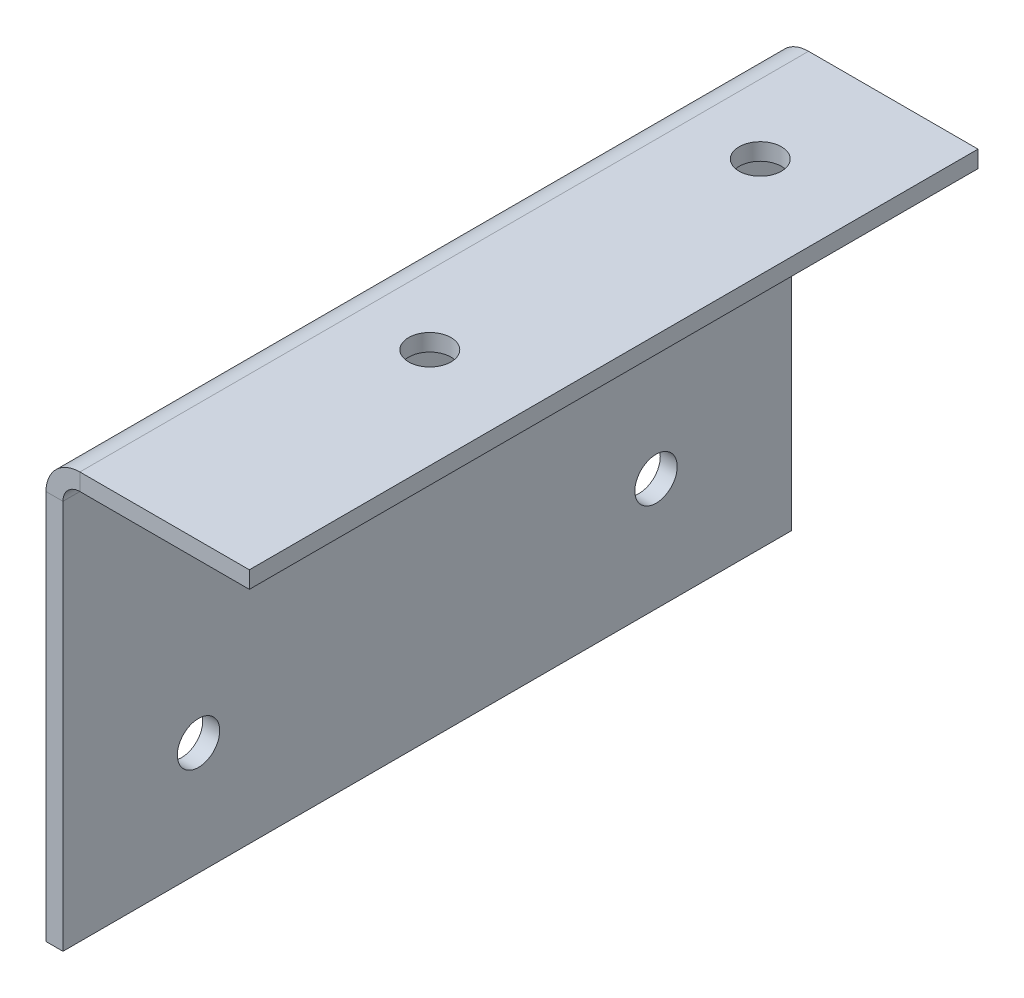
from build123d import *

# Parameters (mm, degrees)
SKETCH1_W                    = 43
SKETCH1_H                    = 25
BASE_FLANGE1_DEPTH           = 1
EDGE_FLANGE1_STRIP_W         = 6
EDGE_FLANGE1_STRIP_H         = 1
EDGE_FLANGE1_STRIP_CUT_DEPTH = 43
EDGE_FLANGE1_DEPTH           = 43
TAP_DRILL_FOR_M3_TAP1_D      = 2.5
TAP_DRILL_FOR_M3_TAP2_D      = 2.5
TAP_DRILL_FOR_M3_TAP2_DEPTH  = 10
TAP_DRILL_FOR_M3_TAP2_TIP    = 0.751075774


# Sheet-metal steps are written as plain solids
with BuildPart() as part:
    # Sketch1 → Base-Flange1 (new body)
    with BuildSketch(Plane(origin=(0, 0, 0), x_dir=(0, 0, -1), z_dir=(1, 0, 0))):
        Rectangle(SKETCH1_W, SKETCH1_H)
    extrude(amount=-BASE_FLANGE1_DEPTH)

    # Edge-Flange1 strip (across the edge) → Edge-Flange1 strip cut (cut)
    with BuildSketch(Plane(origin=(0, 12.5, -21.5), x_dir=(0, -1, 0), z_dir=(0, 0, 1))):
        with Locations((-1, -0.5)):
            Rectangle(EDGE_FLANGE1_STRIP_W, EDGE_FLANGE1_STRIP_H)
    extrude(amount=EDGE_FLANGE1_STRIP_CUT_DEPTH, mode=Mode.SUBTRACT)

    # Edge-Flange1 section (across the edge) → Edge-Flange1 (add)
    with BuildSketch(Plane(origin=(0, 12.5, -21.5), x_dir=(0, -1, 0), z_dir=(0, 0, 1))):
        with BuildLine():
            Line((0, 1), (0, 11))
            Line((0, 11), (1, 11))
            Line((1, 11), (1, 1))
            ThreePointArc((1, 1), (1.292893219, 0.292893219), (2, 0))
            Line((2, 0), (2, -1))
            ThreePointArc((2, -1), (0.585786438, -0.414213562), (0, 1))
        make_face()
    extrude(amount=EDGE_FLANGE1_DEPTH)

    # Tap Drill for M3 Tap1 (through all)
    with Locations(Plane(origin=(-360.471522339, 12.5, -232.457964235), x_dir=(-1, 0, 0), z_dir=(0, 1, 0))):
        with Locations((-365.551522339, 237.387201908), (-365.551522339, 217.887201908)):
            Hole(TAP_DRILL_FOR_M3_TAP1_D / 2)

    # Tap Drill for M3 Tap2
    with Locations(Plane(origin=(2, 426.094482546, -232.457964235), x_dir=(0, 1, 0), z_dir=(1, 0, 0))):
        with Locations((-431.942500863, 218.957964235), (-431.942500863, 245.957964235)):
            Hole(TAP_DRILL_FOR_M3_TAP2_D / 2, depth=TAP_DRILL_FOR_M3_TAP2_DEPTH)
            with Locations((0, 0, -(TAP_DRILL_FOR_M3_TAP2_DEPTH + TAP_DRILL_FOR_M3_TAP2_TIP / 2))):  # 118° drill point
                Cone(0, TAP_DRILL_FOR_M3_TAP2_D / 2, TAP_DRILL_FOR_M3_TAP2_TIP, mode=Mode.SUBTRACT)


solid = part.part
